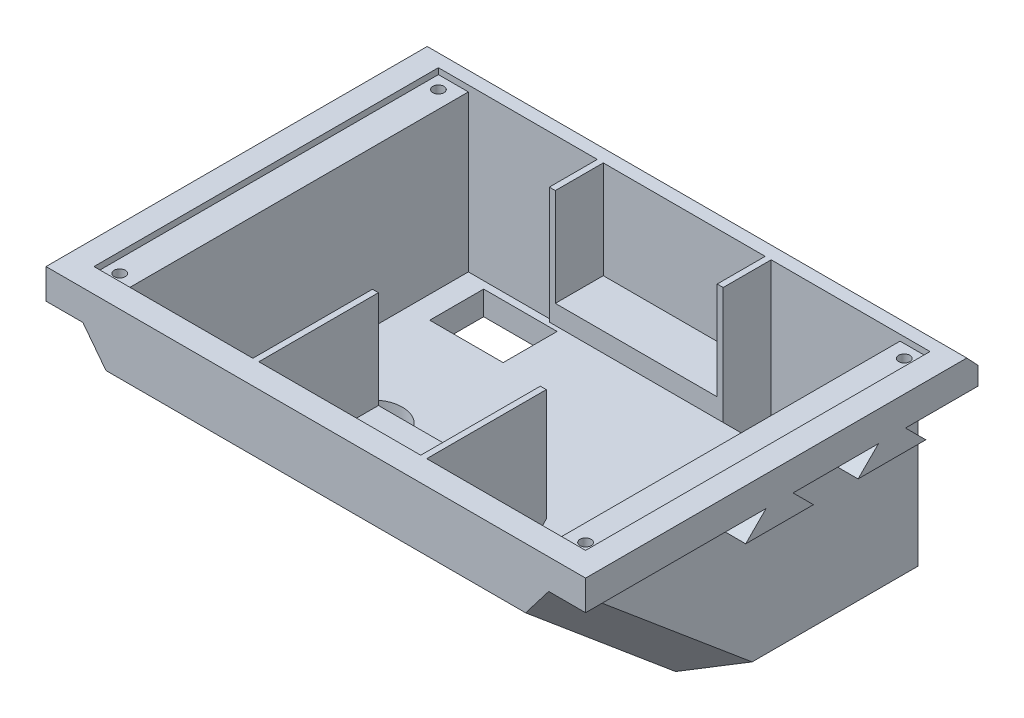
from build123d import *

# Parameters (mm, degrees)
SKETCH1_W           = 80
SKETCH1_H           = 65.45
BOSS_EXTRUDE1_DEPTH = 31
BOSS_EXTRUDE3_DEPTH = 5
CHAMFER2_SIZE       = 25
CHAMFER2_SIZE2      = 20.977490779
SHELL2_START        = -36
SHELL2_DEPTH        = 72
SHELL2_START_2      = -41
SHELL2_2_OUTLINE_W  = 1
SHELL2_2_OUTLINE_H  = 57.45
SHELL2_2_DEPTH      = 82
SKETCH6_R           = 4.86874318
CUT_EXTRUDE1_DEPTH  = 5
BOSS_EXTRUDE4_DEPTH = 8
BOSS_EXTRUDE5_REACH = 107.939
BOSS_EXTRUDE5_START = 29.5
SKETCH10_W          = 12.25
SKETCH10_H          = 9
CUT_EXTRUDE2_DEPTH  = 6
CHAMFER3_SIZE       = 2
CHAMFER3_SIZE2      = 1.865030172
CHAMFER4_SIZE       = 7.098078142
CHAMFER4_SIZE_2     = 10
CHAMFER5_SIZE       = 10
CHAMFER7_SIZE       = 5
SKETCH11_R          = 0.93
CUT_EXTRUDE3_DEPTH  = 7


# Read off the part's stored shape, not the designer's step: Shell2
with BuildPart() as part:
    # Sketch1 → Boss-Extrude1 (new body)
    with BuildSketch(Plane(origin=(0, 0, 0), x_dir=(1, 0, 0), z_dir=(0, 1, 0))):
        Rectangle(SKETCH1_W, SKETCH1_H)
    extrude(amount=BOSS_EXTRUDE1_DEPTH)

    # Sketch5 → Boss-Extrude3 (add)
    with BuildSketch(Plane.ZY.offset(40)):
        Polygon((-32.725, 31), (-20.625, 31), (8.005, 31), (32.725, 31), (32.725, 26), (2.6203214, 26), (6.0203214, 22.6), (-5.2796786, 22.6), (-1.8796786, 26), (-16.125, 26), (-12.725, 22.6), (-24.025, 22.6), (-20.625, 26), (-32.725, 26), align=None)
    boss_extrude3 = extrude(amount=BOSS_EXTRUDE3_DEPTH)

    # Mirror1: Boss-Extrude3 across plane
    add(boss_extrude3.mirror(Plane(origin=(0, 0, 0), x_dir=(0, 0, 1), z_dir=(1, 0, 0))))

    # Chamfer2
    chamfer2_edges = [part.edges().sort_by_distance(p)[0] for p in [
        (0, 0, 32.725),
    ]]
    chamfer2_side = [part.faces().sort_by_distance(p)[0] for p in [
        (0, 0, 0),
    ]]
    chamfer(chamfer2_edges, length=CHAMFER2_SIZE, length2=CHAMFER2_SIZE2, reference=chamfer2_side[0])

    # Shell2 outline → Shell2 (cut)
    with BuildSketch(Plane.YZ.offset(SHELL2_START)):
        Polygon((22.842721412, 28.725), (4, 6.269119063), (4, -28.725), (31, -28.725), (31, 28.725), align=None)
    extrude(amount=SHELL2_DEPTH, mode=Mode.SUBTRACT)

    # Shell2 2 outline → Shell2 2 (cut)
    with BuildSketch(Plane.YZ.offset(SHELL2_START_2)):
        with Locations((30.5, 0)):
            Rectangle(SHELL2_2_OUTLINE_W, SHELL2_2_OUTLINE_H)
    extrude(amount=SHELL2_2_DEPTH, mode=Mode.SUBTRACT)

    # Sketch6 → Cut-Extrude1 (cut)
    with BuildSketch(Plane(origin=(0, 4, 24.632603001), x_dir=(1, 0, 0), z_dir=(0, 1, 0))):
        with Locations(Location((22, 23.453346141, 0), (0, 0, 270))):
            Circle(SKETCH6_R)
        with Locations(Location((-22, 23.453346141, 0), (0, 0, 270))):
            Circle(SKETCH6_R)
    extrude(amount=-CUT_EXTRUDE1_DEPTH, mode=Mode.SUBTRACT)

    # Sketch7 → Boss-Extrude4 (add)
    with BuildSketch(Plane.XY.offset(-28.725)):
        Polygon((-14.5, 13.5), (14.5, 13.5), (14.5, 31), (13.5, 31), (13.5, 14.706896552), (-13.5, 14.706896552), (-13.5, 31), (-14.5, 31), align=None)
    extrude(amount=BOSS_EXTRUDE4_DEPTH)

    # Sketch8 → Boss-Extrude5 (add, up to next)
    with BuildSketch(Plane.XY.offset(-20.725).offset(BOSS_EXTRUDE5_START), mode=Mode.PRIVATE) as boss_extrude5_sk1:
        Polygon((-13.5, 14.706896552), (-13.5, 31), (-14.5, 31), (-14.5, 14.706896552), (-14.5, 13.5), (-13.5, 13.5), (13.5, 13.5), (14.5, 13.5), (14.5, 14.706896552), (14.5, 31), (13.5, 31), (13.5, 14.706896552), align=None)
    boss_extrude5_tool1 = extrude(boss_extrude5_sk1.sketch, amount=BOSS_EXTRUDE5_REACH, mode=Mode.PRIVATE) - part.part
    add(boss_extrude5_tool1.solids().sort_by_distance((14, 30.661289, 8.775))[0])

    # Sketch10 → Cut-Extrude2 (cut)
    with BuildSketch(Plane.XZ):
        with Locations((-26.125, -23.025)):
            Rectangle(SKETCH10_W, SKETCH10_H)
        with Locations((26.125, -23.025)):
            Rectangle(SKETCH10_W, SKETCH10_H)
    extrude(amount=-CUT_EXTRUDE2_DEPTH, mode=Mode.SUBTRACT)

    # Chamfer3
    chamfer3_edges = [part.edges().sort_by_distance(p)[0] for p in [
        (0, 31, -32.725),
    ]]
    chamfer3_side = [part.faces().sort_by_distance(p)[0] for p in [
        (0, 15.756916996, -32.725),
    ]]
    chamfer(chamfer3_edges, length=CHAMFER3_SIZE, length2=CHAMFER3_SIZE2, reference=chamfer3_side[0])

    # Chamfer4
    # the kernel refuses this chamfer: 10, 7.098078142 mm, written as the material it adds along each edge
    with BuildSketch(Plane(origin=(14.5, 13.5, 17.590778193), x_dir=(0, -0.6849156240265527, -0.728622390518105), z_dir=(-1, 0, 0))) as chamfer4_piece_1_section:
        Polygon((CHAMFER4_SIZE * 0.998412410217, -CHAMFER4_SIZE * 0.0563263630269), (CHAMFER4_SIZE_2 * 0.728622390518, -CHAMFER4_SIZE_2 * 0.684915624027), (0, 0), align=None)
    chamfer4_piece_1 = extrude(amount=29, mode=Mode.PRIVATE)
    chamfer4_piece_1 = split(chamfer4_piece_1, bisect_by=Plane(origin=(0, 11.943437141, 8.775), z_dir=(0, 0, 1)), keep=Keep.TOP, mode=Mode.PRIVATE)
    add(chamfer4_piece_1)

    # Chamfer5
    # the kernel refuses this chamfer: 10 mm, written as the material it adds along each edge
    with BuildSketch(Plane(origin=(-14.5, 13.5, -28.725), x_dir=(0, 0.027495876610586317, 0.9996219169112968), z_dir=(1, 0, 0))) as chamfer5_piece_1_section:
        Polygon((CHAMFER5_SIZE * 0.999621916911, CHAMFER5_SIZE * 0.0274958766106), (-CHAMFER5_SIZE * 0.0274958766106, CHAMFER5_SIZE * 0.999621916911), (0, 0), align=None)
    chamfer5_piece_1 = extrude(amount=29, mode=Mode.PRIVATE)
    chamfer5_piece_1 = split(chamfer5_piece_1, bisect_by=Plane(origin=(0, 10.042815877, -20.725), z_dir=(0, 0, -1)), keep=Keep.TOP, mode=Mode.PRIVATE)
    add(chamfer5_piece_1)

    # Chamfer7
    chamfer7_edges = [part.edges().sort_by_distance(p)[0] for p in [
        (40, 10.48874539, 20.225),
        (-40, 10.48874539, 20.225),
        (-40, 13, -32.725),
        (40, 13, -32.725),
    ]]
    chamfer(chamfer7_edges, length=CHAMFER7_SIZE)

    # Sketch11 → Cut-Extrude3 (cut)
    with BuildSketch(Plane(origin=(0, 30, 0), x_dir=(1, 0, 0), z_dir=(0, 1, 0))):
        with Locations(Location((38.849613738, -26.574613738, 0), (0, 0, 270))):
            Circle(SKETCH11_R)
        with Locations(Location((38.849613738, 26.574613738, 0), (0, 0, 90))):
            Circle(SKETCH11_R)
        with Locations(Location((-38.849613738, 26.574613738, 0), (0, 0, 270))):
            Circle(SKETCH11_R)
        with Locations(Location((-38.849613738, -26.574613738, 0), (0, 0, 90))):
            Circle(SKETCH11_R)
    extrude(amount=-CUT_EXTRUDE3_DEPTH, mode=Mode.SUBTRACT)


solid = part.part
